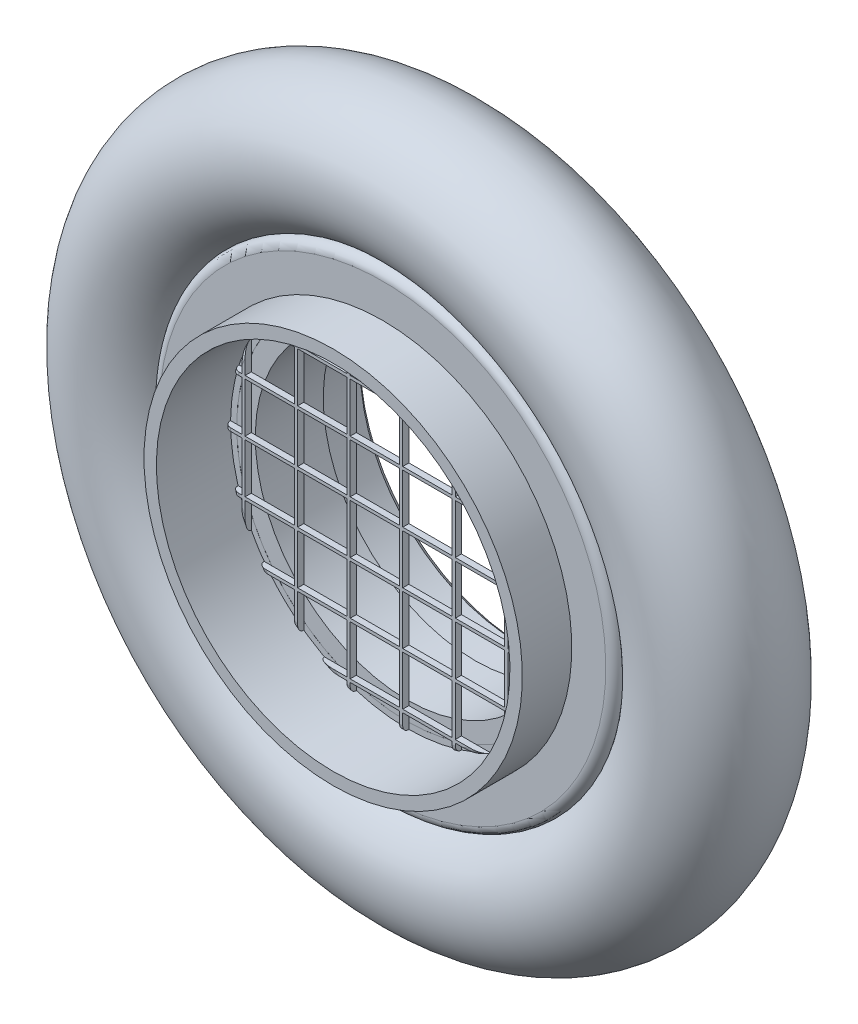
from build123d import *

# Parameters (mm, degrees)
SKETCH3_R                 = 2.744355771
SKETCH7_W                 = 2.032
SKETCH7_H                 = 2.032
CUT_EXTRUDE1_DEPTH        = 0.254
LPATTERN4_COUNT           = 4
LPATTERN4_PITCH           = 2.159
LPATTERN4_COUNT_DIR2      = 6
LPATTERN4_PITCH_DIR2      = 2.159
CIRPATTERN1_START         = 0.0635
CIRPATTERN1_OUTLINE_W     = 2.032
CIRPATTERN1_OUTLINE_H     = 0.254
CIRPATTERN1_OUTLINE_W_2   = 2.4595
CIRPATTERN1_DEPTH         = 2.032
CIRPATTERN1_START_2       = 2.2225
CIRPATTERN1_2_OUTLINE_W   = 2.032
CIRPATTERN1_2_OUTLINE_H   = 0.254
CIRPATTERN1_2_OUTLINE_W_2 = 2.4595
CIRPATTERN1_2_DEPTH       = 2.032
CIRPATTERN1_START_3       = 4.3815
CIRPATTERN1_3_OUTLINE_W   = 2.032
CIRPATTERN1_3_OUTLINE_H   = 0.254
CIRPATTERN1_3_DEPTH       = 2.032
CIRPATTERN1_START_4       = -2.0955
CIRPATTERN1_4_OUTLINE_W   = 2.032
CIRPATTERN1_4_OUTLINE_H   = 0.254
CIRPATTERN1_4_OUTLINE_W_2 = 2.4595
CIRPATTERN1_4_DEPTH       = 2.032
CIRPATTERN1_START_5       = -4.2545
CIRPATTERN1_5_OUTLINE_W   = 2.032
CIRPATTERN1_5_OUTLINE_H   = 0.254
CIRPATTERN1_5_OUTLINE_W_2 = 2.4595
CIRPATTERN1_5_DEPTH       = 2.032
CIRPATTERN1_START_6       = -6.4135
CIRPATTERN1_6_OUTLINE_W   = 2.032
CIRPATTERN1_6_OUTLINE_H   = 0.254
CIRPATTERN1_6_DEPTH       = 2.032
CIRPATTERN1_START_7       = 6.5405
CIRPATTERN1_7_OUTLINE_W   = 2.032
CIRPATTERN1_7_OUTLINE_H   = 0.254
CIRPATTERN1_7_DEPTH       = 0.72362246
CIRPATTERN1_START_8       = -7.26412256
CIRPATTERN1_8_OUTLINE_W   = 2.032
CIRPATTERN1_8_OUTLINE_H   = 0.254
CIRPATTERN1_8_DEPTH       = 0.72362256


# Read off the part's stored shape, not the designer's step: CirPattern1
with BuildPart() as part:
    # Sketch2 → Revolve1 (revolve)
    with BuildSketch(Plane(origin=(0, 0, 0), x_dir=(0, 0, -1), z_dir=(1, 0, 0)), mode=Mode.PRIVATE) as revolve1_sk:
        with BuildLine():
            Line((-1.905, 7.7724), (-1.905, 9.1694))
            ThreePointArc((-1.905, 9.1694), (-1.793407684, 9.438807684), (-1.524, 9.5504))
            ThreePointArc((-1.524, 9.5504), (0, 9.088348459), (1.524, 9.5504))
            ThreePointArc((1.524, 9.5504), (1.793407684, 9.438807684), (1.905, 9.1694))
            Line((1.905, 9.1694), (1.905, 7.7724))
            Line((1.905, 7.7724), (3.937, 7.7724))
            Line((3.937, 7.7724), (3.937, 7.2644))
            Line((3.937, 7.2644), (-3.937, 7.2644))
            Line((-3.937, 7.2644), (-3.937, 7.7724))
            Line((-3.937, 7.7724), (-1.905, 7.7724))
        make_face()
    revolve(revolve1_sk.sketch.rotate(Axis((0, 0, 3.937), (0, 0, -1)), 180), axis=Axis((0, 0, 3.937), (0, 0, -1)))


with BuildPart() as body_2:
    # Sketch3 → Revolve2 (revolve)
    with BuildSketch(Plane(origin=(0, 0, 0), x_dir=(0, 0, -1), z_dir=(1, 0, 0))):
        with Locations((0, 11.832704229)):
            Circle(SKETCH3_R)
    revolve(axis=Axis((0, 0, 3.937), (0, 0, -1)))


with BuildPart() as body_3:
    # Sketch5 → Revolve3 (revolve)
    with BuildSketch(Plane(origin=(0, 0, 0), x_dir=(0, 0, -1), z_dir=(1, 0, 0)), mode=Mode.PRIVATE) as revolve3_sk:
        Polygon((-0.889, 7.0104), (-0.889, 6.2484), (1.905, 6.2484), (1.905, 6.5024), (3.683, 6.5024), (3.937, 6.7564), (3.937, 7.0104), align=None)
    revolve(revolve3_sk.sketch.rotate(Axis((0, 0, 3.937), (0, 0, -1)), 180), axis=Axis((0, 0, 3.937), (0, 0, -1)))


with BuildPart() as body_4:
    # Sketch6 → Revolve4 (revolve)
    with BuildSketch(Plane(origin=(0, 0, 0), x_dir=(0, 0, -1), z_dir=(1, 0, 0)), mode=Mode.PRIVATE) as revolve4_sk:
        with BuildLine():
            Line((3.937, 7.2644), (-0.889, 7.2644))
            ThreePointArc((-0.889, 7.2644), (-1.068605122, 7.190005122), (-1.143, 7.0104))
            Line((-1.143, 7.0104), (-1.143, 0))
            Line((-1.143, 0), (-0.889, 0))
            Line((-0.889, 0), (-0.889, 7.0104))
            Line((-0.889, 7.0104), (3.937, 7.0104))
            Line((3.937, 7.0104), (3.937, 7.2644))
        make_face()
    revolve(revolve4_sk.sketch.rotate(Axis((0, 0, 1.143), (0, 0, -1)), 180), axis=Axis((0, 0, 1.143), (0, 0, -1)))

    # Sketch7 → Cut-Extrude1 (cut)
    with BuildSketch(Plane.XY.offset(1.143)):
        with Locations((-1.0795, 1.0795)):
            Rectangle(SKETCH7_W, SKETCH7_H)
    cut_extrude1 = extrude(amount=-CUT_EXTRUDE1_DEPTH, mode=Mode.SUBTRACT)

    # LPattern4: Cut-Extrude1 4 × 6
    with Locations(*[(-j * LPATTERN4_PITCH_DIR2, i * LPATTERN4_PITCH, 0) for i in range(LPATTERN4_COUNT) for j in range(LPATTERN4_COUNT_DIR2) if (i, j) != (0, 0)]):
        add(cut_extrude1, mode=Mode.SUBTRACT)

    # CirPattern1 outline → CirPattern1 (cut)
    with BuildSketch(Plane.YZ.offset(CIRPATTERN1_START)):
        with Locations((1.0795, 1.016)):
            Rectangle(CIRPATTERN1_OUTLINE_W, CIRPATTERN1_OUTLINE_H)
        with Locations((-1.0795, 1.016)):
            Rectangle(CIRPATTERN1_OUTLINE_W, CIRPATTERN1_OUTLINE_H)
        with Locations((3.2385, 1.016)):
            Rectangle(CIRPATTERN1_OUTLINE_W, CIRPATTERN1_OUTLINE_H)
        with Locations((-3.2385, 1.016)):
            Rectangle(CIRPATTERN1_OUTLINE_W, CIRPATTERN1_OUTLINE_H)
        with Locations((5.3975, 1.016)):
            Rectangle(CIRPATTERN1_OUTLINE_W, CIRPATTERN1_OUTLINE_H)
        with Locations((-5.3975, 1.016)):
            Rectangle(CIRPATTERN1_OUTLINE_W, CIRPATTERN1_OUTLINE_H)
        with Locations((7.77025, 1.016)):
            Rectangle(CIRPATTERN1_OUTLINE_W_2, CIRPATTERN1_OUTLINE_H)
        with Locations((-7.77025, 1.016)):
            Rectangle(CIRPATTERN1_OUTLINE_W_2, CIRPATTERN1_OUTLINE_H)
    extrude(amount=CIRPATTERN1_DEPTH, mode=Mode.SUBTRACT)

    # CirPattern1 2 outline → CirPattern1 2 (cut)
    with BuildSketch(Plane.YZ.offset(CIRPATTERN1_START_2)):
        with Locations((1.0795, 1.016)):
            Rectangle(CIRPATTERN1_2_OUTLINE_W, CIRPATTERN1_2_OUTLINE_H)
        with Locations((-1.0795, 1.016)):
            Rectangle(CIRPATTERN1_2_OUTLINE_W, CIRPATTERN1_2_OUTLINE_H)
        with Locations((3.2385, 1.016)):
            Rectangle(CIRPATTERN1_2_OUTLINE_W, CIRPATTERN1_2_OUTLINE_H)
        with Locations((-3.2385, 1.016)):
            Rectangle(CIRPATTERN1_2_OUTLINE_W, CIRPATTERN1_2_OUTLINE_H)
        with Locations((5.3975, 1.016)):
            Rectangle(CIRPATTERN1_2_OUTLINE_W, CIRPATTERN1_2_OUTLINE_H)
        with Locations((-5.3975, 1.016)):
            Rectangle(CIRPATTERN1_2_OUTLINE_W, CIRPATTERN1_2_OUTLINE_H)
        with Locations((7.77025, 1.016)):
            Rectangle(CIRPATTERN1_2_OUTLINE_W_2, CIRPATTERN1_2_OUTLINE_H)
        with Locations((-7.77025, 1.016)):
            Rectangle(CIRPATTERN1_2_OUTLINE_W_2, CIRPATTERN1_2_OUTLINE_H)
    extrude(amount=CIRPATTERN1_2_DEPTH, mode=Mode.SUBTRACT)

    # CirPattern1 3 outline → CirPattern1 3 (cut)
    with BuildSketch(Plane.YZ.offset(CIRPATTERN1_START_3)):
        with Locations((1.0795, 1.016)):
            Rectangle(CIRPATTERN1_3_OUTLINE_W, CIRPATTERN1_3_OUTLINE_H)
        with Locations((-1.0795, 1.016)):
            Rectangle(CIRPATTERN1_3_OUTLINE_W, CIRPATTERN1_3_OUTLINE_H)
        with Locations((3.2385, 1.016)):
            Rectangle(CIRPATTERN1_3_OUTLINE_W, CIRPATTERN1_3_OUTLINE_H)
        with Locations((-3.2385, 1.016)):
            Rectangle(CIRPATTERN1_3_OUTLINE_W, CIRPATTERN1_3_OUTLINE_H)
        with Locations((5.3975, 1.016)):
            Rectangle(CIRPATTERN1_3_OUTLINE_W, CIRPATTERN1_3_OUTLINE_H)
        with Locations((-5.3975, 1.016)):
            Rectangle(CIRPATTERN1_3_OUTLINE_W, CIRPATTERN1_3_OUTLINE_H)
    extrude(amount=CIRPATTERN1_3_DEPTH, mode=Mode.SUBTRACT)

    # CirPattern1 4 outline → CirPattern1 4 (cut)
    with BuildSketch(Plane.YZ.offset(CIRPATTERN1_START_4)):
        with Locations((-1.0795, 1.016)):
            Rectangle(CIRPATTERN1_4_OUTLINE_W, CIRPATTERN1_4_OUTLINE_H)
        with Locations((-3.2385, 1.016)):
            Rectangle(CIRPATTERN1_4_OUTLINE_W, CIRPATTERN1_4_OUTLINE_H)
        with Locations((-5.3975, 1.016)):
            Rectangle(CIRPATTERN1_4_OUTLINE_W, CIRPATTERN1_4_OUTLINE_H)
        with Locations((-7.77025, 1.016)):
            Rectangle(CIRPATTERN1_4_OUTLINE_W_2, CIRPATTERN1_4_OUTLINE_H)
    extrude(amount=CIRPATTERN1_4_DEPTH, mode=Mode.SUBTRACT)

    # CirPattern1 5 outline → CirPattern1 5 (cut)
    with BuildSketch(Plane.YZ.offset(CIRPATTERN1_START_5)):
        with Locations((-1.0795, 1.016)):
            Rectangle(CIRPATTERN1_5_OUTLINE_W, CIRPATTERN1_5_OUTLINE_H)
        with Locations((-3.2385, 1.016)):
            Rectangle(CIRPATTERN1_5_OUTLINE_W, CIRPATTERN1_5_OUTLINE_H)
        with Locations((-5.3975, 1.016)):
            Rectangle(CIRPATTERN1_5_OUTLINE_W, CIRPATTERN1_5_OUTLINE_H)
        with Locations((-7.77025, 1.016)):
            Rectangle(CIRPATTERN1_5_OUTLINE_W_2, CIRPATTERN1_5_OUTLINE_H)
    extrude(amount=CIRPATTERN1_5_DEPTH, mode=Mode.SUBTRACT)

    # CirPattern1 6 outline → CirPattern1 6 (cut)
    with BuildSketch(Plane.YZ.offset(CIRPATTERN1_START_6)):
        with Locations((-1.0795, 1.016)):
            Rectangle(CIRPATTERN1_6_OUTLINE_W, CIRPATTERN1_6_OUTLINE_H)
        with Locations((-3.2385, 1.016)):
            Rectangle(CIRPATTERN1_6_OUTLINE_W, CIRPATTERN1_6_OUTLINE_H)
        with Locations((-5.3975, 1.016)):
            Rectangle(CIRPATTERN1_6_OUTLINE_W, CIRPATTERN1_6_OUTLINE_H)
    extrude(amount=CIRPATTERN1_6_DEPTH, mode=Mode.SUBTRACT)

    # CirPattern1 7 outline → CirPattern1 7 (cut)
    with BuildSketch(Plane.YZ.offset(CIRPATTERN1_START_7)):
        with Locations((1.0795, 1.016)):
            Rectangle(CIRPATTERN1_7_OUTLINE_W, CIRPATTERN1_7_OUTLINE_H)
        with Locations((-1.0795, 1.016)):
            Rectangle(CIRPATTERN1_7_OUTLINE_W, CIRPATTERN1_7_OUTLINE_H)
        with Locations((3.2385, 1.016)):
            Rectangle(CIRPATTERN1_7_OUTLINE_W, CIRPATTERN1_7_OUTLINE_H)
        with Locations((-3.2385, 1.016)):
            Rectangle(CIRPATTERN1_7_OUTLINE_W, CIRPATTERN1_7_OUTLINE_H)
    extrude(amount=CIRPATTERN1_7_DEPTH, mode=Mode.SUBTRACT)

    # CirPattern1 8 outline → CirPattern1 8 (cut)
    with BuildSketch(Plane.YZ.offset(CIRPATTERN1_START_8)):
        with Locations((-1.0795, 1.016)):
            Rectangle(CIRPATTERN1_8_OUTLINE_W, CIRPATTERN1_8_OUTLINE_H)
        with Locations((-3.2385, 1.016)):
            Rectangle(CIRPATTERN1_8_OUTLINE_W, CIRPATTERN1_8_OUTLINE_H)
    extrude(amount=CIRPATTERN1_8_DEPTH, mode=Mode.SUBTRACT)


solid = Compound([part.part, body_2.part, body_3.part, body_4.part])
